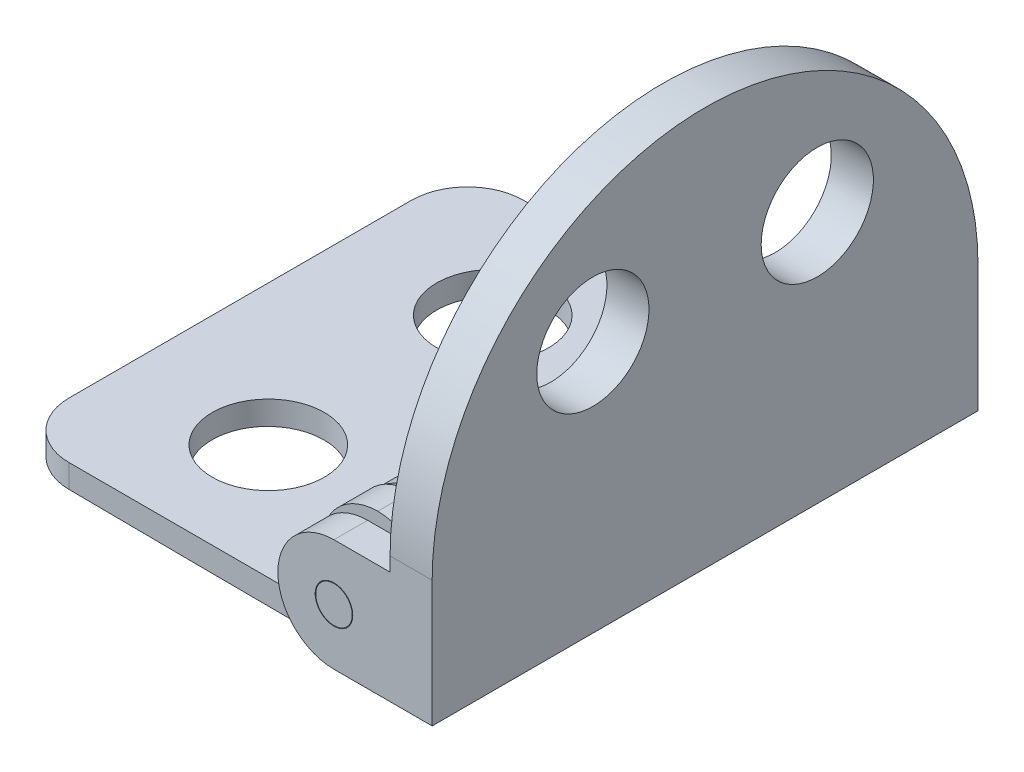
from build123d import *

# Parameters (mm, degrees)
BOSS_EXTRUDE1_DEPTH = 0.75
SKETCH2_W           = 2
SKETCH2_H           = 0.6
BOSS_EXTRUDE2_DEPTH = 2
FILLET1_R           = 1
SKETCH4_W           = 8.1
SKETCH4_H           = 7.5
BOSS_EXTRUDE3_DEPTH = 0.449838501
SKETCH6_W           = 2
SKETCH6_H           = 0.6
BOSS_EXTRUDE4_DEPTH = 2
FILLET2_R           = 1
SKETCH8_R           = 0.335
CUT_EXTRUDE1_DEPTH  = 41.002126506
FILLET3_R           = 1
SKETCH9_R           = 0.325
BOSS_EXTRUDE5_DEPTH = 9.73
SKETCH10_R          = 1
BOSS_EXTRUDE6_DEPTH = 3.35
SKETCH13_R          = 1
CUT_EXTRUDE2_DEPTH  = 59.038894071
SKETCH11_R          = 1
CUT_EXTRUDE3_DEPTH  = 52.600481829
CAVITY1_START       = 38.07
CAVITY1_DEPTH       = 8.1


# Read off the part's stored shape, not the designer's step: Cavity1
with BuildPart() as part:
    # Sketch1 → Boss-Extrude1 (new body)
    with BuildSketch(Plane(origin=(-25, 0, 0), x_dir=(0, -1, 0), z_dir=(-1, 0, 0))):
        with BuildLine():
            Line((-15.05, 47), (-12.8, 47))
            Line((-12.8, 47), (-12.8, 37.27))
            Line((-12.8, 37.27), (-15.05, 37.27))
            ThreePointArc((-15.05, 37.27), (-19.915, 42.135), (-15.05, 47))
        make_face()
    extrude(amount=BOSS_EXTRUDE1_DEPTH)

    # Sketch2 → Boss-Extrude2 (add)
    with BuildSketch(Plane(origin=(-25.75, 0, 0), x_dir=(0, -1, 0), z_dir=(-1, 0, 0))):
        with Locations((-13.8, 46.7)):
            Rectangle(SKETCH2_W, SKETCH2_H)
        with Locations((-13.8, 37.57)):
            Rectangle(SKETCH2_W, SKETCH2_H)
    extrude(amount=BOSS_EXTRUDE2_DEPTH)

    # Fillet1
    fillet1_edges = [part.edges().sort_by_distance(p)[0] for p in [
        (-27.75, 14.8, 37.57),
        (-27.75, 12.8, 37.57),
        (-27.75, 14.8, 46.7),
        (-27.75, 12.8, 46.7),
    ]]
    fillet(fillet1_edges, radius=FILLET1_R - 0.0001)  # a hair under: the kernel refuses the full size


with BuildPart() as body_2:
    # Sketch4 → Boss-Extrude3 (new body)
    with BuildSketch(Plane(origin=(0, 12.350161499, 0), x_dir=(0, 0, -1), z_dir=(0, 1, 0))):
        with Locations((-42.12, 29.55)):
            Rectangle(SKETCH4_W, SKETCH4_H)
    extrude(amount=BOSS_EXTRUDE3_DEPTH)

    # Sketch6 → Boss-Extrude4 (add)
    with BuildSketch(Plane(origin=(0, 12.8, 0), x_dir=(1, 0, 0), z_dir=(0, 1, 0))):
        with Locations((-26.8, -45.87)):
            Rectangle(SKETCH6_W, SKETCH6_H)
        with Locations((-26.8, -38.37)):
            Rectangle(SKETCH6_W, SKETCH6_H)
    extrude(amount=BOSS_EXTRUDE4_DEPTH)

    # Fillet2
    fillet2_edges = [body_2.edges().sort_by_distance(p)[0] for p in [
        (-25.8, 14.8, 45.87),
        (-27.8, 14.8, 45.87),
        (-25.8, 14.8, 38.37),
        (-27.8, 14.8, 38.37),
    ]]
    fillet(fillet2_edges, radius=FILLET2_R - 0.0001)  # a hair under: the kernel refuses the full size


with BuildPart() as cut_extrude1_tool:
    # Sketch8 → Cut-Extrude1 (new, through all)
    with BuildSketch(Plane.XY.offset(47)):
        with Locations((-26.75, 13.8)):
            Circle(SKETCH8_R)
    extrude(amount=-CUT_EXTRUDE1_DEPTH)


with BuildPart() as part_1:
    add(part.part)

    # Cut-Extrude1: cut by cut_extrude1_tool
    add(cut_extrude1_tool.part, mode=Mode.SUBTRACT)

    # Sketch11 → Cut-Extrude3 (cut, through all)
    with BuildSketch(Plane(origin=(-25.75, 0, 0), x_dir=(0, -1, 0), z_dir=(-1, 0, 0))):
        with Locations(Location((-17.3, 40.135, 0), (0, 0, 90))):
            Circle(SKETCH11_R)
        with Locations(Location((-17.3, 44.135, 0), (0, 0, 90))):
            Circle(SKETCH11_R)
    extrude(amount=-CUT_EXTRUDE3_DEPTH, mode=Mode.SUBTRACT)


with BuildPart() as body_2_1:
    add(body_2.part)

    # Cut-Extrude1: cut by cut_extrude1_tool
    add(cut_extrude1_tool.part, mode=Mode.SUBTRACT)

    # Fillet3
    fillet3_edges = [body_2_1.edges().sort_by_distance(p)[0] for p in [
        (-33.3, 12.575080749, 38.07),
        (-33.3, 12.575080749, 46.17),
    ]]
    fillet(fillet3_edges, radius=FILLET3_R)

    # Sketch13 → Cut-Extrude2 (cut, through all)
    with BuildSketch(Plane(origin=(0, 12.8, 0), x_dir=(-1, 0, 0), z_dir=(0, 1, 0))):
        with Locations(Location((30.8, 44.12, 0), (0, 0, 90))):
            Circle(SKETCH13_R)
        with Locations(Location((30.8, 40.12, 0), (0, 0, 90))):
            Circle(SKETCH13_R)
    extrude(amount=-CUT_EXTRUDE2_DEPTH, mode=Mode.SUBTRACT)

    # Cavity1 outline → Cavity1 (cut)
    with BuildSketch(Plane.XY.offset(CAVITY1_START)):
        with BuildLine():
            ThreePointArc((-25.8, 12.350413972), (-29.550054299, 12.363391445), (-33.300001511, 12.394561456))
            Line((-33.300001511, 12.394561456), (-33.3, 12.350161499))
            Line((-33.3, 12.350161499), (-25.8, 12.350161499))
            Line((-25.8, 12.350161499), (-25.8, 12.350413972))
        make_face()
    extrude(amount=CAVITY1_DEPTH, mode=Mode.SUBTRACT)


with BuildPart() as body_3:
    # Sketch9 → Boss-Extrude5 (new body)
    with BuildSketch(Plane.XY.offset(47)):
        with Locations((-26.75, 13.8)):
            Circle(SKETCH9_R)
    extrude(amount=-BOSS_EXTRUDE5_DEPTH)

    # Sketch10 → Boss-Extrude6 (add, symmetric)
    with BuildSketch(Plane(origin=(0, 0, 42.135), x_dir=(-1, 0, 0), z_dir=(0, 0, -1))):
        with Locations((26.75, 13.8)):
            Circle(SKETCH10_R)
    extrude(amount=BOSS_EXTRUDE6_DEPTH, both=True)


solid = Compound([part_1.part, body_2_1.part, body_3.part])
